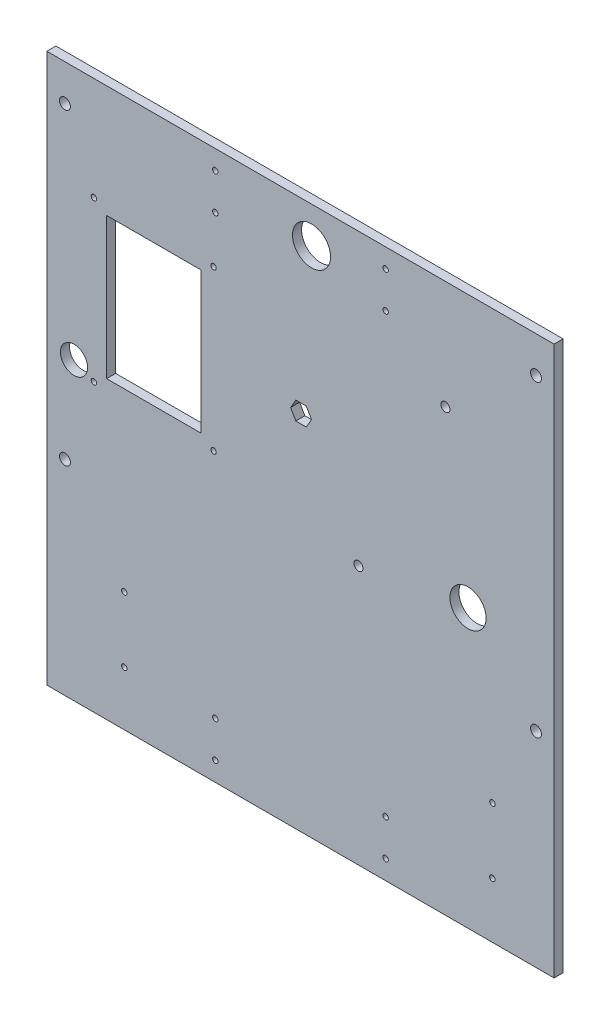
from build123d import *

# Parameters (mm, degrees)
ESQUISSE1_W             = 280
ESQUISSE1_H             = 210
BOSS_EXTRU_1_DEPTH      = 5
ESQUISSE2_R             = 3
ESQUISSE2_R_2           = 2.5
ESQUISSE2_R_3           = 1.5
ESQUISSE2_R_4           = 7.5
ESQUISSE2_R_5           = 10.5
ESQUISSE2_R_6           = 10
ESQUISSE2_W             = 52
ESQUISSE2_H             = 78
ENL_V_MAT_EXTRU_1_DEPTH = 351.035712464
ESQUISSE5_R             = 1.5
ENL_V_MAT_EXTRU_3_DEPTH = 351.035712464
ESQUISSE6_W             = 280
ESQUISSE6_H             = 93
BOSS_EXTRU_4_DEPTH      = 5
ESQUISSE7_R             = 1.5
ENL_V_MAT_EXTRU_4_DEPTH = 351.035712464
ESQUISSE8_R             = 1.5
ENL_V_MAT_EXTRU_5_DEPTH = 351.035712464
ESQUISSE9_R             = 1.5
ENL_V_MAT_EXTRU_6_DEPTH = 351.035712464


with BuildPart() as part:
    # Esquisse1 → Boss.-Extru.1 (new body)
    with BuildSketch(Plane.XY):
        with Locations((140, 105)):
            Rectangle(ESQUISSE1_W, ESQUISSE1_H)
    extrude(amount=BOSS_EXTRU_1_DEPTH)

    # Esquisse2 → Enlèv. mat.-Extru.1 (cut, through all)
    with BuildSketch(Plane.XY):
        with Locations((270, 190)):
            Circle(ESQUISSE2_R)
        with Locations((10, 190)):
            Circle(ESQUISSE2_R)
        with Locations((10, 20)):
            Circle(ESQUISSE2_R)
        with Locations((270, 20)):
            Circle(ESQUISSE2_R)
        with Locations((220, 150)):
            Circle(ESQUISSE2_R_2)
        with Locations((172, 50)):
            Circle(ESQUISSE2_R_2)
        with Locations((92, 153)):
            Circle(ESQUISSE2_R_3)
        with Locations((26, 153)):
            Circle(ESQUISSE2_R_3)
        with Locations((92, 65)):
            Circle(ESQUISSE2_R_3)
        with Locations((26, 65)):
            Circle(ESQUISSE2_R_3)
        with Locations((15, 70)):
            Circle(ESQUISSE2_R_4)
        with Locations((146.093717203, 190)):
            Circle(ESQUISSE2_R_5)
        with Locations((232.477054828, 60.19739042)):
            Circle(ESQUISSE2_R_6)
        with Locations((59, 109)):
            Rectangle(ESQUISSE2_W, ESQUISSE2_H)
        Polygon((137.433463165, 111.971416316), (134.546711819, 106.971416316), (137.433463165, 101.971416316), (143.206965857, 101.971416316), (146.093717203, 106.971416316), (143.206965857, 111.971416316), align=None)
    extrude(amount=ENL_V_MAT_EXTRU_1_DEPTH, mode=Mode.SUBTRACT)

    # Esquisse5 → Enlèv. mat.-Extru.3 (cut, through all)
    with BuildSketch(Plane(origin=(0, 0, 0), x_dir=(-1, 0, 0), z_dir=(0, 0, -1))):
        with Locations((-93, 179.4)):
            Circle(ESQUISSE5_R)
        with Locations((-93, 199.4)):
            Circle(ESQUISSE5_R)
        with Locations((-187, 199.4)):
            Circle(ESQUISSE5_R)
        with Locations((-187, 179.4)):
            Circle(ESQUISSE5_R)
    extrude(amount=-ENL_V_MAT_EXTRU_3_DEPTH, mode=Mode.SUBTRACT)

    # Esquisse6 → Boss.-Extru.4 (add)
    with BuildSketch(Plane(origin=(0, 0, 0), x_dir=(-1, 0, 0), z_dir=(0, 0, -1))):
        with Locations((-140, -46.5)):
            Rectangle(ESQUISSE6_W, ESQUISSE6_H)
    extrude(amount=-BOSS_EXTRU_4_DEPTH)

    # Esquisse7 → Enlèv. mat.-Extru.4 (cut, through all)
    with BuildSketch(Plane(origin=(0, 0, 0), x_dir=(-1, 0, 0), z_dir=(0, 0, -1))):
        with Locations((-42.785302695, -27.055649919)):
            Circle(ESQUISSE7_R)
        with Locations((-42.773346208, -63.039616064)):
            Circle(ESQUISSE7_R)
    extrude(amount=-ENL_V_MAT_EXTRU_4_DEPTH, mode=Mode.SUBTRACT)

    # Esquisse8 → Enlèv. mat.-Extru.5 (cut, through all)
    with BuildSketch(Plane(origin=(0, 0, 0), x_dir=(-1, 0, 0), z_dir=(0, 0, -1))):
        with Locations((-245.944892865, -62.344865672)):
            Circle(ESQUISSE8_R)
        with Locations((-245.944892865, -26.360897541)):
            Circle(ESQUISSE8_R)
    extrude(amount=-ENL_V_MAT_EXTRU_5_DEPTH, mode=Mode.SUBTRACT)

    # Esquisse9 → Enlèv. mat.-Extru.6 (cut, through all)
    with BuildSketch(Plane(origin=(0, 0, 0), x_dir=(-1, 0, 0), z_dir=(0, 0, -1))):
        with Locations((-93, -62.4)):
            Circle(ESQUISSE9_R)
        with Locations((-93, -82.4)):
            Circle(ESQUISSE9_R)
        with Locations((-187, -82.4)):
            Circle(ESQUISSE9_R)
        with Locations((-187, -62.4)):
            Circle(ESQUISSE9_R)
    extrude(amount=-ENL_V_MAT_EXTRU_6_DEPTH, mode=Mode.SUBTRACT)


solid = part.part
